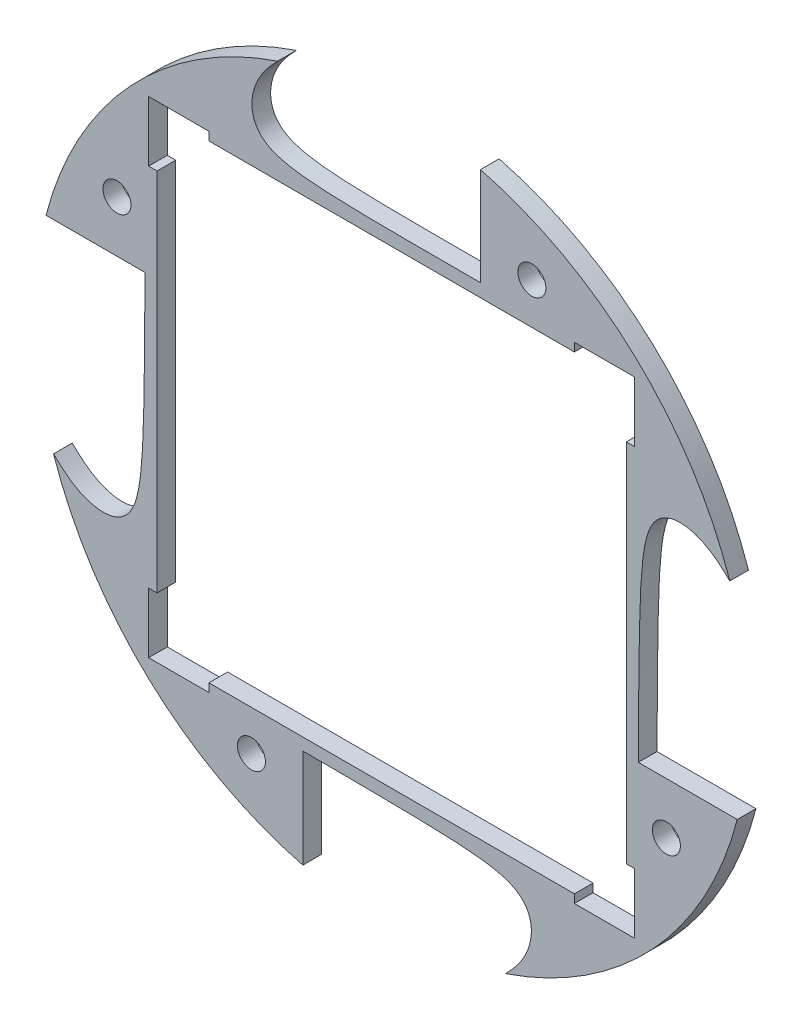
from build123d import *

# Parameters (mm, degrees)
BOSS_EXTRUDE3_OUTLINE_R = 3
BOSS_EXTRUDE3_DEPTH     = 4
CUT_EXTRUDE1_DEPTH      = 4
CUT_EXTRUDE2_DEPTH      = 4
SKETCH4_W               = 0.4
SKETCH4_H               = 1.8
SKETCH4_W_2             = 1.8
SKETCH4_H_2             = 0.4
BOSS_EXTRUDE4_DEPTH     = 4


# Read off the part's stored shape, not the designer's step: Boss-Extrude3
with BuildPart() as part:
    # Boss-Extrude3 outline → Boss-Extrude3 (new body)
    with BuildSketch(Plane.XY):
        with BuildLine():
            add(Edge.make_bspline(
                [(24.392810524, -72.348554199), (27.040667073, -69.541086329), (29.089162938, -67.428574969), (30.241441862, -64.355831171), (31.073643307, -60.963009895), (30.561519341, -59.042545022), (29.217193929, -56.673971678), (27.488775543, -54.241382838), (25.105954954, -53), (17.37432721, -53), (-19, -52.782560411)],
                knots=[0, 0, 0, 0, 0, 0, 0, 0, 0, 0, 0, 1, 1, 1, 1, 1, 1, 1, 1, 1, 1, 1], degree=10))
            ThreePointArc((24.392810524, -72.348554199), (55.939709188, -51.962211615), (73.948106805, -19))
            Line((73.948106805, -19), (52.782560411, -19))
            add(Edge.make_bspline(
                [(72.348554199, 24.392810524), (69.541086329, 27.040667073), (67.428574969, 29.089162938), (64.355831171, 30.241441862), (60.963009895, 31.073643307), (59.042545022, 30.561519341), (56.673971678, 29.217193929), (54.241382838, 27.488775543), (53, 25.105954954), (53, 17.37432721), (52.782560411, -19)],
                knots=[0, 0, 0, 0, 0, 0, 0, 0, 0, 0, 0, 1, 1, 1, 1, 1, 1, 1, 1, 1, 1, 1], degree=10))
            ThreePointArc((72.348554199, 24.392810524), (51.962211615, 55.939709188), (19, 73.948106805))
            Line((19, 73.948106805), (19, 53))
            add(Edge.make_bspline(
                [(-24.392810524, 72.348554199), (-27.040667073, 69.541086329), (-29.089162938, 67.428574969), (-30.241441862, 64.355831171), (-31.073643307, 60.963009895), (-30.561519341, 59.042545022), (-29.217193929, 56.673971678), (-27.488775543, 54.241382838), (-25.105954954, 53), (-17.37432721, 53), (19, 53)],
                knots=[0, 0, 0, 0, 0, 0, 0, 0, 0, 0, 0, 1, 1, 1, 1, 1, 1, 1, 1, 1, 1, 1], degree=10))
            ThreePointArc((-24.392810524, 72.348554199), (-55.939709188, 51.962211615), (-73.948106805, 19))
            Line((-73.948106805, 19), (-52.782560411, 19))
            add(Edge.make_bspline(
                [(-72.348554199, -24.392810524), (-69.541086329, -27.040667073), (-67.428574969, -29.089162938), (-64.355831171, -30.241441862), (-60.963009895, -31.073643307), (-59.042545022, -30.561519341), (-56.673971678, -29.217193929), (-54.241382838, -27.488775543), (-53, -25.105954954), (-53, -17.37432721), (-52.782560411, 19)],
                knots=[0, 0, 0, 0, 0, 0, 0, 0, 0, 0, 0, 1, 1, 1, 1, 1, 1, 1, 1, 1, 1, 1], degree=10))
            ThreePointArc((-72.348554199, -24.392810524), (-51.962211615, -55.939709188), (-19, -73.948106805))
            Line((-19, -73.948106805), (-19, -52.782560411))
        make_face()
        with Locations((-30, -58.782560411)):
            Circle(BOSS_EXTRUDE3_OUTLINE_R, mode=Mode.SUBTRACT)
        with Locations((58.782560411, -30)):
            Circle(BOSS_EXTRUDE3_OUTLINE_R, mode=Mode.SUBTRACT)
        with Locations((-58.782560411, 30)):
            Circle(BOSS_EXTRUDE3_OUTLINE_R, mode=Mode.SUBTRACT)
        Polygon((-38.9, -51.6), (-51.6, -51.6), (-51.6, -38.9), (-50, -38.9), (-50, 38.9), (-51.6, 38.9), (-51.6, 51.6), (-38.9, 51.6), (-38.9, 50), (38.9, 50), (38.9, 51.6), (51.6, 51.6), (51.6, 38.9), (50, 38.9), (50, -38.9), (51.6, -38.9), (51.6, -51.6), (38.9, -51.6), (38.9, -50), (-38.9, -50), align=None, mode=Mode.SUBTRACT)
        with Locations((30, 59)):
            Circle(BOSS_EXTRUDE3_OUTLINE_R, mode=Mode.SUBTRACT)
    extrude(amount=BOSS_EXTRUDE3_DEPTH)

    # Sketch2 → Cut-Extrude1 (cut)
    with BuildSketch(Plane.XY.offset(4)):
        Polygon((51.8, -38.7), (50.2, -38.7), (50.2, 38.7), (51.8, 38.7), (51.8, 51.8), (38.7, 51.8), (38.7, 50.2), (-38.7, 50.2), (-38.7, 51.8), (-51.8, 51.8), (-51.8, 38.7), (-50.2, 38.7), (-50.2, -38.7), (-51.8, -38.7), (-51.8, -51.8), (-38.7, -51.8), (-38.7, -50.2), (38.7, -50.2), (38.7, -51.8), (51.8, -51.8), align=None)
        Polygon((51.6, -38.9), (50, -38.9), (50, 38.9), (51.6, 38.9), (51.6, 51.6), (38.9, 51.6), (38.9, 50), (-38.9, 50), (-38.9, 51.6), (-51.6, 51.6), (-51.6, 38.9), (-50, 38.9), (-50, -38.9), (-51.6, -38.9), (-51.6, -51.6), (-38.9, -51.6), (-38.9, -50), (38.9, -50), (38.9, -51.6), (51.6, -51.6), align=None, mode=Mode.SUBTRACT)
    extrude(amount=-CUT_EXTRUDE1_DEPTH, mode=Mode.SUBTRACT)

    # Sketch3 → Cut-Extrude2 (cut)
    with BuildSketch(Plane.XY.offset(4)):
        Polygon((-51.8, -51.8), (-38.7, -51.8), (-38.7, -52), (-52, -52), (-52, -38.7), (-51.8, -38.7), align=None)
        Polygon((38.7, -51.8), (51.8, -51.8), (51.8, -38.7), (52, -38.7), (52, -52), (38.7, -52), align=None)
        Polygon((51.8, 38.7), (51.8, 51.8), (38.7, 51.8), (38.7, 52), (52, 52), (52, 38.7), align=None)
        Polygon((-51.8, 51.8), (-51.8, 38.7), (-52, 38.7), (-52, 52), (-38.7, 52), (-38.7, 51.8), align=None)
    extrude(amount=-CUT_EXTRUDE2_DEPTH, mode=Mode.SUBTRACT)

    # Sketch4 → Boss-Extrude4 (add)
    with BuildSketch(Plane.XY.offset(4)):
        with Locations((-38.9, 51.1)):
            Rectangle(SKETCH4_W, SKETCH4_H)
        with Locations((-51.1, 38.9)):
            Rectangle(SKETCH4_W_2, SKETCH4_H_2)
        with Locations((38.9, 51.1)):
            Rectangle(SKETCH4_W, SKETCH4_H)
        with Locations((51.1, 38.9)):
            Rectangle(SKETCH4_W_2, SKETCH4_H_2)
        with Locations((38.9, -51.1)):
            Rectangle(SKETCH4_W, SKETCH4_H)
        with Locations((51.1, -38.9)):
            Rectangle(SKETCH4_W_2, SKETCH4_H_2)
        with Locations((-51.1, -38.9)):
            Rectangle(SKETCH4_W_2, SKETCH4_H_2)
        with Locations((-38.9, -51.1)):
            Rectangle(SKETCH4_W, SKETCH4_H)
    extrude(amount=-BOSS_EXTRUDE4_DEPTH)


solid = part.part
